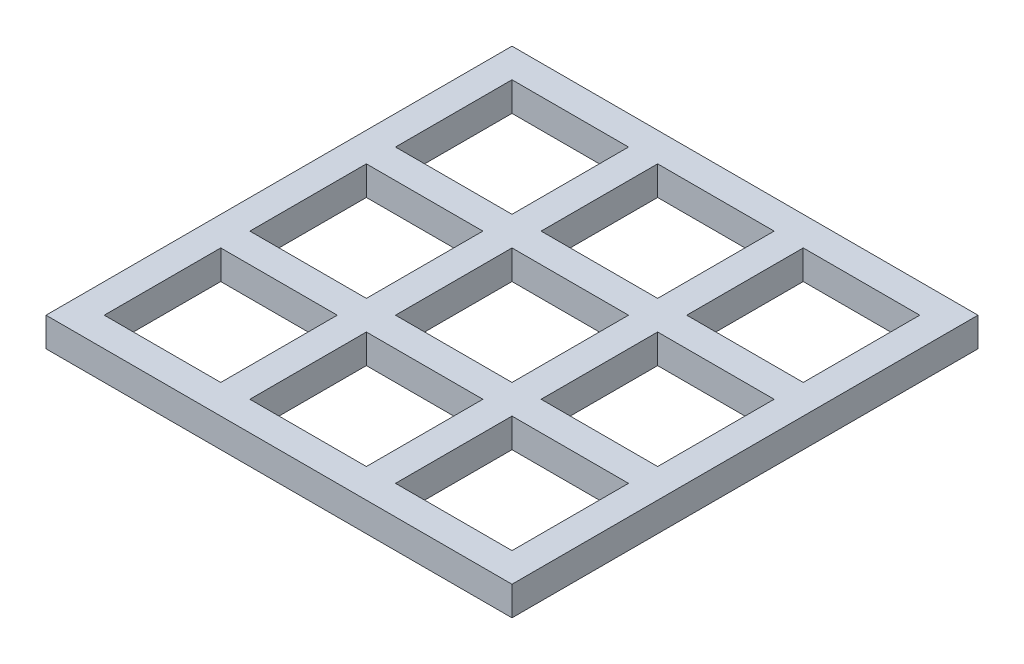
from build123d import *

# Parameters (mm, degrees)
SKETCH2_W            = 320
SKETCH2_H            = 320
BOSS_EXTRUDE1_DEPTH  = 20
SKETCH3_W            = 80
SKETCH3_H            = 80
CUT_EXTRUDE1_DEPTH   = 228.156333832
LPATTERN1_COUNT      = 3
LPATTERN1_PITCH      = 100
LPATTERN1_COUNT_DIR2 = 3
LPATTERN1_PITCH_DIR2 = 100


with BuildPart() as part:
    # Sketch2 → Boss-Extrude1 (new body)
    with BuildSketch(Plane(origin=(0, 0, 0), x_dir=(1, 0, 0), z_dir=(0, 1, 0))):
        Rectangle(SKETCH2_W, SKETCH2_H)
    extrude(amount=BOSS_EXTRUDE1_DEPTH)

    # Sketch3 → Cut-Extrude1 (cut, through all)
    with BuildSketch(Plane(origin=(0, 20, 0), x_dir=(1, 0, 0), z_dir=(0, 1, 0))):
        with Locations((-100, 100)):
            Rectangle(SKETCH3_W, SKETCH3_H)
    cut_extrude1 = extrude(amount=-CUT_EXTRUDE1_DEPTH, mode=Mode.SUBTRACT)

    # LPattern1: Cut-Extrude1 3 × 3
    with Locations(*[(i * LPATTERN1_PITCH, 0, j * LPATTERN1_PITCH_DIR2) for i in range(LPATTERN1_COUNT) for j in range(LPATTERN1_COUNT_DIR2) if (i, j) != (0, 0)]):
        add(cut_extrude1, mode=Mode.SUBTRACT)


solid = part.part
